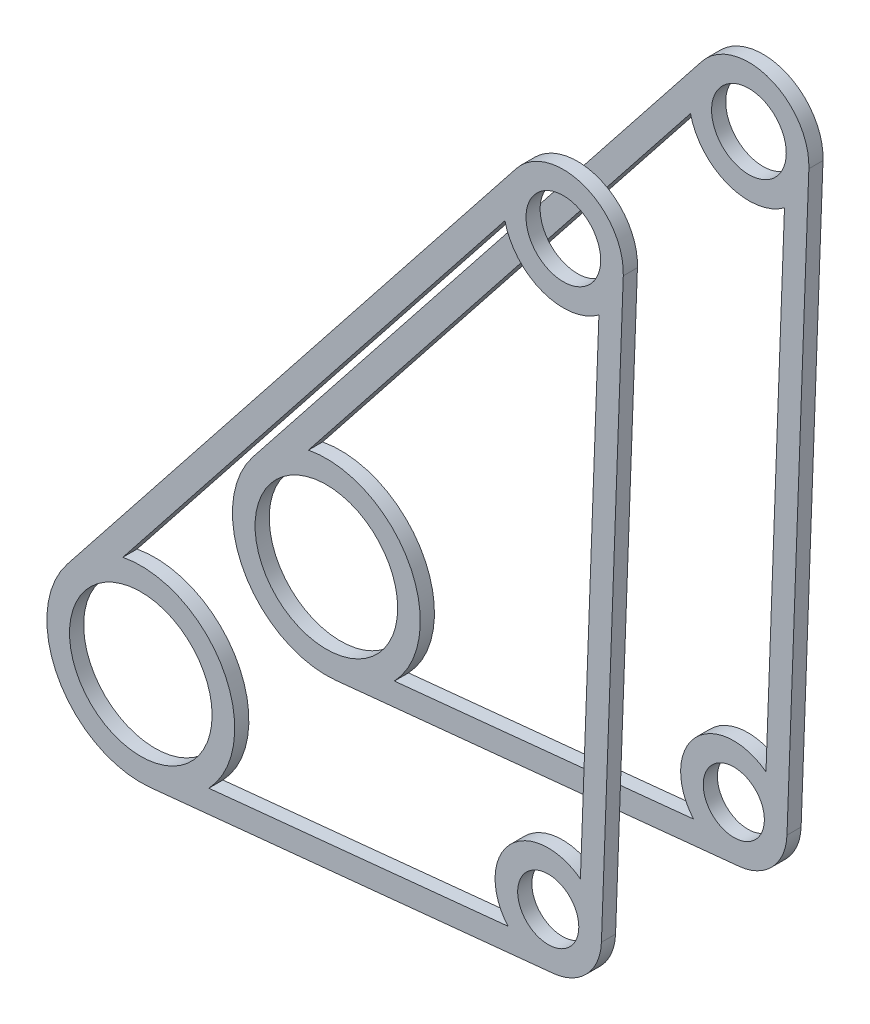
from build123d import *

# Parameters (mm, degrees)
BOSS_EXTRUDE1_START = 9.61771
SKETCH1_R           = 8.001
SKETCH1_R_2         = 4.191
SKETCH1_R_3         = 3.429
BOSS_EXTRUDE1_DEPTH = 1.5875
BOSS_EXTRUDE2_START = -9.61771
SKETCH1_4_R         = 8.001
SKETCH1_4_R_2       = 4.191
SKETCH1_4_R_3       = 3.429
BOSS_EXTRUDE2_DEPTH = 1.5875


with BuildPart() as part:
    # Sketch1 → Boss-Extrude1 (new body)
    with BuildSketch(Plane.XY.offset(BOSS_EXTRUDE1_START)):
        with BuildLine():
            ThreePointArc((-8.264104742, 6.543489422), (-9.247450164, -5.059382025), (1.0541, -10.488162575))
            Line((1.0541, -10.488162575), (46.3169, -5.939080012))
            ThreePointArc((46.3169, -5.939080012), (50.071526337, -4.085728764), (51.684874278, -0.221891526))
            Line((51.684874278, -0.221891526), (54.139680923, 65.768068925))
            ThreePointArc((54.139680923, 65.768068925), (49.743182937, 72.33320285), (42.136254402, 70.196659792))
            Line((42.136254402, 70.196659792), (-8.264104742, 6.543489422))
        make_face()
        Circle(SKETCH1_R, mode=Mode.SUBTRACT)
        with BuildLine():
            Line((-2.01262532, 10.347077864), (40.857998083, 64.490562984))
            ThreePointArc((40.857998083, 64.490562984), (45.083483729, 59.703371208), (51.405639077, 60.599075292))
            Line((51.405639077, 60.599075292), (49.328254105, 4.754940937))
            ThreePointArc((49.328254105, 4.754940937), (41.368473663, 4.085728764), (41.201602766, -3.900390677))
            Line((41.201602766, -3.900390677), (7.628402366, -7.274624275))
            ThreePointArc((7.628402366, -7.274624275), (9.247450164, 5.059382025), (-2.01262532, 10.347077864))
        make_face(mode=Mode.SUBTRACT)
        with Locations((47.413333333, 66.018287029)):
            Circle(SKETCH1_R_2, mode=Mode.SUBTRACT)
        with Locations((45.72, 0)):
            Circle(SKETCH1_R_3, mode=Mode.SUBTRACT)
    extrude(amount=BOSS_EXTRUDE1_DEPTH)


with BuildPart() as body_2:
    # Sketch1<4> → Boss-Extrude2 (new body)
    with BuildSketch(Plane.XY.offset(BOSS_EXTRUDE2_START)):
        with BuildLine():
            ThreePointArc((-8.264104742, 6.543489422), (-9.247450164, -5.059382025), (1.0541, -10.488162575))
            Line((1.0541, -10.488162575), (46.3169, -5.939080012))
            ThreePointArc((46.3169, -5.939080012), (50.071526337, -4.085728764), (51.684874278, -0.221891526))
            Line((51.684874278, -0.221891526), (54.139680923, 65.768068925))
            ThreePointArc((54.139680923, 65.768068925), (49.743182937, 72.33320285), (42.136254402, 70.196659792))
            Line((42.136254402, 70.196659792), (-8.264104742, 6.543489422))
        make_face()
        Circle(SKETCH1_4_R, mode=Mode.SUBTRACT)
        with BuildLine():
            Line((-2.01262532, 10.347077864), (40.857998083, 64.490562984))
            ThreePointArc((40.857998083, 64.490562984), (45.083483729, 59.703371208), (51.405639077, 60.599075292))
            Line((51.405639077, 60.599075292), (49.328254105, 4.754940937))
            ThreePointArc((49.328254105, 4.754940937), (41.368473663, 4.085728764), (41.201602766, -3.900390677))
            Line((41.201602766, -3.900390677), (7.628402366, -7.274624275))
            ThreePointArc((7.628402366, -7.274624275), (9.247450164, 5.059382025), (-2.01262532, 10.347077864))
        make_face(mode=Mode.SUBTRACT)
        with Locations((47.413333333, 66.018287029)):
            Circle(SKETCH1_4_R_2, mode=Mode.SUBTRACT)
        with Locations((45.72, 0)):
            Circle(SKETCH1_4_R_3, mode=Mode.SUBTRACT)
    extrude(amount=-BOSS_EXTRUDE2_DEPTH)


solid = Compound([part.part, body_2.part])
